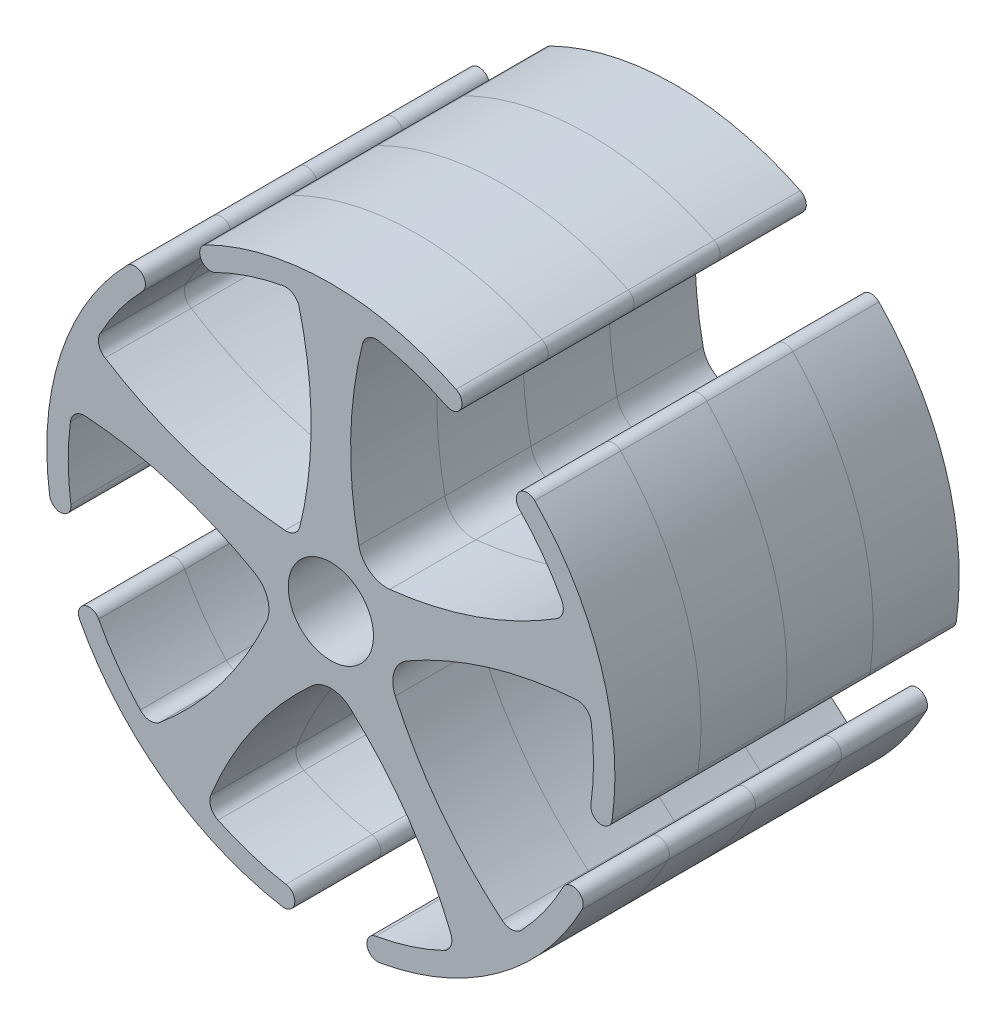
from build123d import *
from OCP.BRepFilletAPI import BRepFilletAPI_MakeFillet

# Parameters (mm, degrees)
BOSS_EXTRUDE3_DEPTH = 3.03
CIRPATTERN1_COUNT   = 5
SKETCH6_R           = 1.5
CUT_EXTRUDE1_DEPTH  = 82
FILLET1_R1          = 0.5
FILLET1_R2          = 1
LPATTERN1_COUNT     = 4
LPATTERN1_PITCH     = 3.03


with BuildPart() as part:
    # Sketch2 → Boss-Extrude3 (new body)
    with BuildSketch(Plane.XY):
        with BuildLine():
            Line((-1.754642488, 0), (1.754642488, 0))
            ThreePointArc((1.754642488, 0), (0.718103074, 4.537559536), (1.233533665, 9.163377497))
            ThreePointArc((1.233533665, 9.163377497), (2.688942378, 8.846393691), (4.074565131, 8.299819965))
            ThreePointArc((4.074565131, 8.299819965), (4.57910056, 8.472094445), (4.40682608, 8.976629874))
            ThreePointArc((4.40682608, 8.976629874), (0, 10), (-4.40682608, 8.976629874))
            ThreePointArc((-4.40682608, 8.976629874), (-4.57910056, 8.472094445), (-4.074565131, 8.299819965))
            ThreePointArc((-4.074565131, 8.299819965), (-2.688942378, 8.846393691), (-1.233533665, 9.163377497))
            ThreePointArc((-1.233533665, 9.163377497), (-0.718103074, 4.537559536), (-1.754642488, 0))
        make_face()
    extrude(amount=-BOSS_EXTRUDE3_DEPTH)

    # CirPattern1: part ×5 about axis
    cirpattern1_axis = Axis((0, 0, 0), (0, 0, -1))


with BuildPart() as part_1:
    add(part.part)
    for i in range(1, CIRPATTERN1_COUNT):
        add(part.part.rotate(cirpattern1_axis, i * 360 / CIRPATTERN1_COUNT))

    # Sketch6 → Cut-Extrude1 (cut)
    with BuildSketch(Plane(origin=(0, 0, -3.03), x_dir=(-1, 0, 0), z_dir=(0, 0, -1))):
        Circle(SKETCH6_R)
    extrude(amount=-CUT_EXTRUDE1_DEPTH, mode=Mode.SUBTRACT)

    # Fillet1: one fillet with a radius per group of edges: ONE call of the kernel's fillet builder (fillet() takes one radius for all edges)
    fillet1_edges_1 = [part_1.edges().sort_by_distance(p)[0] for p in [
        (-1.192367006, 1.64115239, -1.515),
        (-1.233533665, 9.163377497, -1.515),
        (1.233533665, 9.163377497, -1.515),
        (-8.333707014, 4.004799602, -1.515),
        (-9.096072745, 1.658479142, -1.515),
        (-6.384047852, -6.688275224, -1.515),
        (6.384047852, -6.688275224, -1.515),
        (-4.388148456, -8.138381017, -1.515),
        (4.388148456, -8.138381017, -1.515),
        (9.096072745, 1.658479142, -1.515),
        (8.333707014, 4.004799602, -1.515),
    ]]
    fillet1_edges_2 = [part_1.edges().sort_by_distance(p)[0] for p in [
        (-1.929290343, -0.626864432, -1.515),
        (0, -2.028575916, -1.515),
        (1.929290343, -0.626864432, -1.515),
        (1.192367006, 1.64115239, -1.515),
    ]]
    fillet1 = BRepFilletAPI_MakeFillet(part_1.part.solid().wrapped)
    for e in fillet1_edges_1:
        fillet1.Add(FILLET1_R1, e.wrapped)
    for e in fillet1_edges_2:
        fillet1.Add(FILLET1_R2, e.wrapped)
    add(Compound.cast(fillet1.Shape()), mode=Mode.REPLACE)


with BuildPart() as lpattern1_1:
    # LPattern1: pattern copy
    add(part_1.part.moved(Location(Vector(0, 0, 1) * (1 * LPATTERN1_PITCH))))


with BuildPart() as lpattern1_2:
    # LPattern1: pattern copy
    add(part_1.part.moved(Location(Vector(0, 0, 1) * (2 * LPATTERN1_PITCH))))


with BuildPart() as lpattern1_3:
    # LPattern1: pattern copy
    add(part_1.part.moved(Location(Vector(0, 0, 1) * (3 * LPATTERN1_PITCH))))


solid = Compound([part_1.part, lpattern1_1.part, lpattern1_2.part, lpattern1_3.part])
